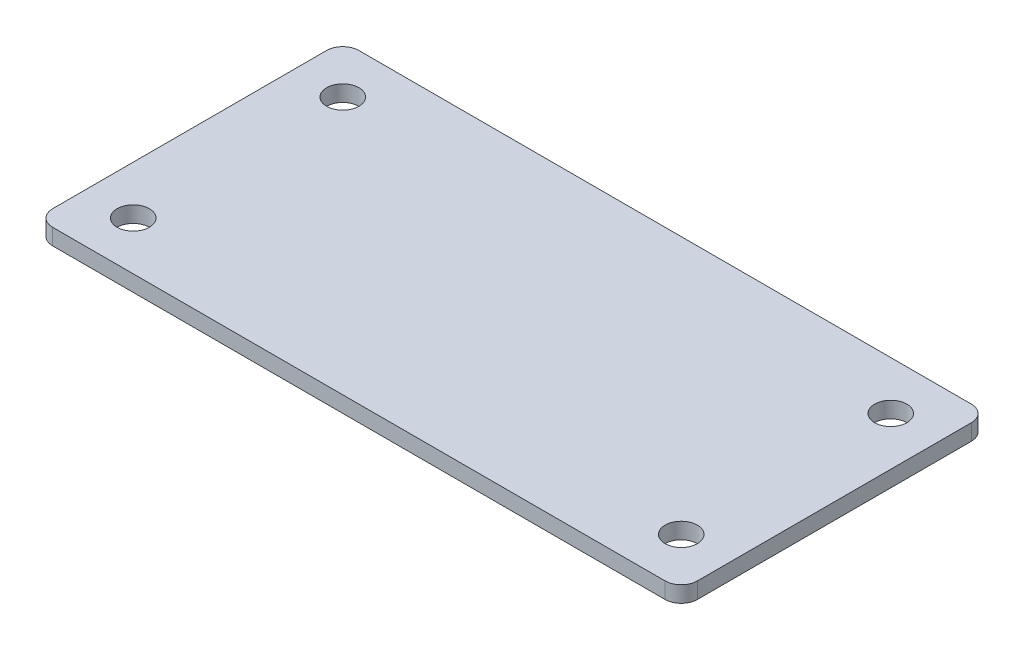
from build123d import *

# Parameters (mm, degrees)
SALIENTE_EXTRUIR1_DEPTH   = 1
CROQUIS2_R                = 1
CORTAR_EXTRUIR1_DEPTH     = 23.164160259
SIMETR_A2_COPY_1_SKETCH_R = 1
SIMETR_A2_COPY_1_DEPTH    = 23.164160259


with BuildPart() as part:
    # Croquis1 → Saliente-Extruir1 (new body)
    with BuildSketch(Plane(origin=(0, 0, 0), x_dir=(1, 0, 0), z_dir=(0, 1, 0))):
        with BuildLine():
            Line((-19, -9.5), (19, -9.5))
            ThreePointArc((19, -9.5), (19.707106781, -9.207106781), (20, -8.5))
            Line((20, -8.5), (20, 8.5))
            ThreePointArc((20, 8.5), (19.707106781, 9.207106781), (19, 9.5))
            Line((19, 9.5), (-19, 9.5))
            ThreePointArc((-19, 9.5), (-19.707106781, 9.207106781), (-20, 8.5))
            Line((-20, 8.5), (-20, -8.5))
            ThreePointArc((-20, -8.5), (-19.707106781, -9.207106781), (-19, -9.5))
        make_face()
    extrude(amount=SALIENTE_EXTRUIR1_DEPTH)

    # Croquis2 → Cortar-Extruir1 (cut, through all)
    with BuildSketch(Plane.XZ):
        with Locations((17, 6.5)):
            Circle(CROQUIS2_R)
    cortar_extruir1 = extrude(amount=-CORTAR_EXTRUIR1_DEPTH, mode=Mode.SUBTRACT)

    # Simetría1: Cortar-Extruir1 across plane
    add(cortar_extruir1.mirror(Plane(origin=(0, 0, 0), x_dir=(1, 0, 0), z_dir=(0, 0, -1))), mode=Mode.SUBTRACT)

    # Simetría2: Cortar-Extruir1 across plane
    add(cortar_extruir1.mirror(Plane(origin=(0, 0, 0), x_dir=(0, 0, 1), z_dir=(1, 0, 0))), mode=Mode.SUBTRACT)

    # Simetría2 copy 1 sketch → Simetría2 copy 1 (cut, through all)
    with BuildSketch(Plane(origin=(0, 0, 0), x_dir=(-1, 0, 0), z_dir=(0, -1, 0))):
        with Locations((17, 6.5)):
            Circle(SIMETR_A2_COPY_1_SKETCH_R)
    extrude(amount=-SIMETR_A2_COPY_1_DEPTH, mode=Mode.SUBTRACT)


solid = part.part
